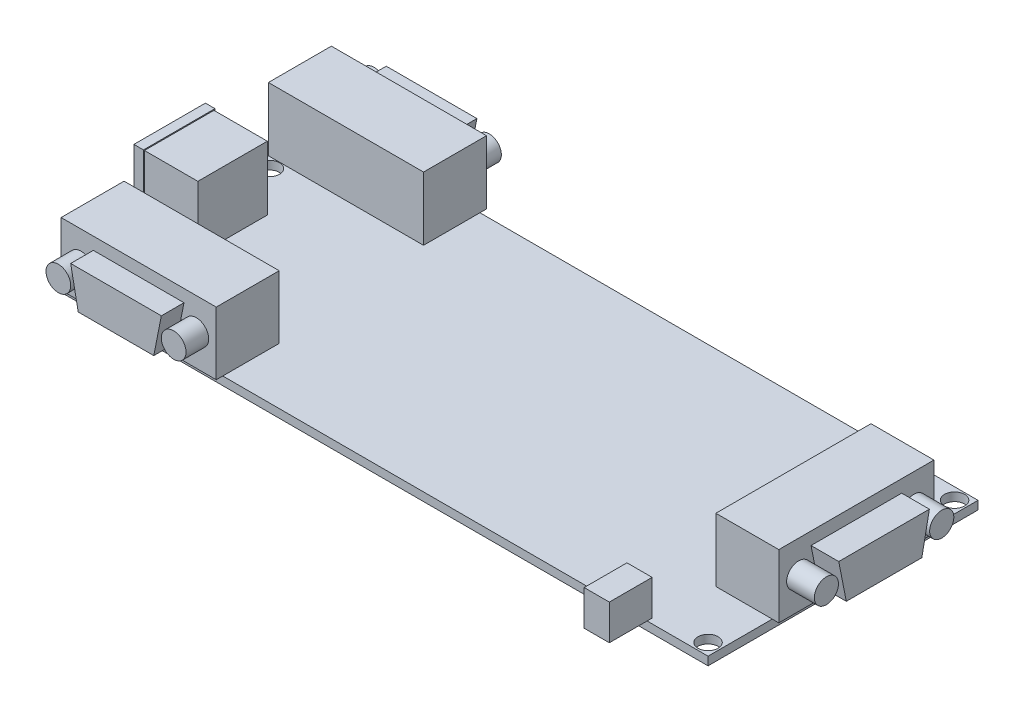
from build123d import *

# Parameters (mm, degrees)
SKETCH1_W           = 129.7
SKETCH1_H           = 53.6
BOARDBASE_DEPTH     = 1.67
SKETCH3_W           = 12.5
SKETCH3_H           = 30.8
BOSS_EXTRUDE2_DEPTH = 12.6
SKETCH4_R           = 2.4
BOSS_EXTRUDE3_DEPTH = 5.5
SKETCH6_W           = 30.8
SKETCH6_H           = 12.5
BOSS_EXTRUDE5_DEPTH = 12.5
SKETCH7_R           = 2.45
BOSS_EXTRUDE6_DEPTH = 4.5
SKETCH5_W           = 30.8
SKETCH5_H           = 12.5
BOSS_EXTRUDE4_DEPTH = 12.6
SKETCH9_R           = 2.4
BOSS_EXTRUDE7_DEPTH = 4.5
SKETCH10_W          = 10.6
SKETCH10_H          = 13.8
BOSS_EXTRUDE8_DEPTH = 12.7
SKETCH12_W          = 14.2
SKETCH12_H          = 13.1
BOSS_EXTRUDE9_DEPTH = 1.9
SKETCH13_W          = 5.2
SKETCH13_H          = 46.3
MOLEXHEADER_DEPTH   = 2.7
SKETCH14_R          = 2
MOUNTHOLES_DEPTH    = 80.767740973
SKETCH15_W          = 5
SKETCH15_H          = 8.5
STIMHEADER_DEPTH    = 7


with BuildPart() as part:
    # Sketch1 → BoardBase (new body)
    with BuildSketch(Plane(origin=(0, 0, 0), x_dir=(1, 0, 0), z_dir=(0, 1, 0))):
        Rectangle(SKETCH1_W, SKETCH1_H)
    extrude(amount=BOARDBASE_DEPTH)

    # Sketch3 → Boss-Extrude2 (add)
    with BuildSketch(Plane(origin=(0, 1.67, 0), x_dir=(1, 0, 0), z_dir=(0, 1, 0))):
        with Locations((59.9, 1.35)):
            Rectangle(SKETCH3_W, SKETCH3_H)
    extrude(amount=BOSS_EXTRUDE2_DEPTH)

    # Sketch4 → Boss-Extrude3 (add)
    with BuildSketch(Plane(origin=(66.15, 0, 0), x_dir=(0, 0, -1), z_dir=(1, 0, 0))):
        with Locations((-10.1, 7.97)):
            Circle(SKETCH4_R)
        with Locations((12.8, 7.97)):
            Circle(SKETCH4_R)
        Polygon((-7.65, 11.77), (10.35, 11.77), (8.85, 4.17), (-6.15, 4.17), align=None)
    extrude(amount=BOSS_EXTRUDE3_DEPTH)

    # Sketch6 → Boss-Extrude5 (add)
    with BuildSketch(Plane(origin=(0, 1.67, 0), x_dir=(1, 0, 0), z_dir=(0, 1, 0))):
        with Locations((-46.9, -21.85)):
            Rectangle(SKETCH6_W, SKETCH6_H)
    extrude(amount=BOSS_EXTRUDE5_DEPTH)

    # Sketch7 → Boss-Extrude6 (add)
    with BuildSketch(Plane.XY.offset(28.1)):
        with Locations((-58.35, 7.92)):
            Circle(SKETCH7_R)
        with Locations((-35.45, 7.92)):
            Circle(SKETCH7_R)
        Polygon((-55.9, 11.72), (-37.9, 11.72), (-39.4, 4.12), (-54.4, 4.12), align=None)
    extrude(amount=BOSS_EXTRUDE6_DEPTH)

    # Sketch5 → Boss-Extrude4 (add)
    with BuildSketch(Plane(origin=(0, 1.67, 0), x_dir=(1, 0, 0), z_dir=(0, 1, 0))):
        with Locations((-49.44, 21.85)):
            Rectangle(SKETCH5_W, SKETCH5_H)
    extrude(amount=BOSS_EXTRUDE4_DEPTH)

    # Sketch9 → Boss-Extrude7 (add)
    with BuildSketch(Plane(origin=(0, 0, -28.1), x_dir=(-1, 0, 0), z_dir=(0, 0, -1))):
        with Locations((37.99, 7.97)):
            Circle(SKETCH9_R)
        with Locations((60.89, 7.97)):
            Circle(SKETCH9_R)
        Polygon((40.44, 11.77), (58.44, 11.77), (56.94, 4.17), (41.94, 4.17), align=None)
    extrude(amount=BOSS_EXTRUDE7_DEPTH)

    # Sketch10 → Boss-Extrude8 (add)
    with BuildSketch(Plane(origin=(0, 1.67, 0), x_dir=(1, 0, 0), z_dir=(0, 1, 0))):
        with Locations((-60.05, -1.6)):
            Rectangle(SKETCH10_W, SKETCH10_H)
    extrude(amount=BOSS_EXTRUDE8_DEPTH)

    # Sketch12 → Boss-Extrude9 (add)
    with BuildSketch(Plane.ZY.offset(65.35)):
        with Locations((1.6, 8.02)):
            Rectangle(SKETCH12_W, SKETCH12_H)
    extrude(amount=BOSS_EXTRUDE9_DEPTH)

    # Sketch13 → MolexHeader (add)
    with BuildSketch(Plane.XZ):
        with Locations((45.75, -2.65)):
            Rectangle(SKETCH13_W, SKETCH13_H)
    extrude(amount=MOLEXHEADER_DEPTH)

    # Sketch14 → MountHoles (cut, through all)
    with BuildSketch(Plane(origin=(0, 1.67, 0), x_dir=(1, 0, 0), z_dir=(0, 1, 0))):
        with Locations((62.5, 24.5)):
            Circle(SKETCH14_R)
        with Locations((62.5, -24.45)):
            Circle(SKETCH14_R)
        with Locations((-62.55, -12.9)):
            Circle(SKETCH14_R)
        with Locations((-62.55, 13.5)):
            Circle(SKETCH14_R)
    extrude(amount=-MOUNTHOLES_DEPTH, mode=Mode.SUBTRACT)

    # Sketch15 → StimHeader (add)
    with BuildSketch(Plane(origin=(0, 1.67, 0), x_dir=(1, 0, 0), z_dir=(0, 1, 0))):
        with Locations((50.25, -30.05)):
            Rectangle(SKETCH15_W, SKETCH15_H)
    extrude(amount=STIMHEADER_DEPTH)


solid = part.part
